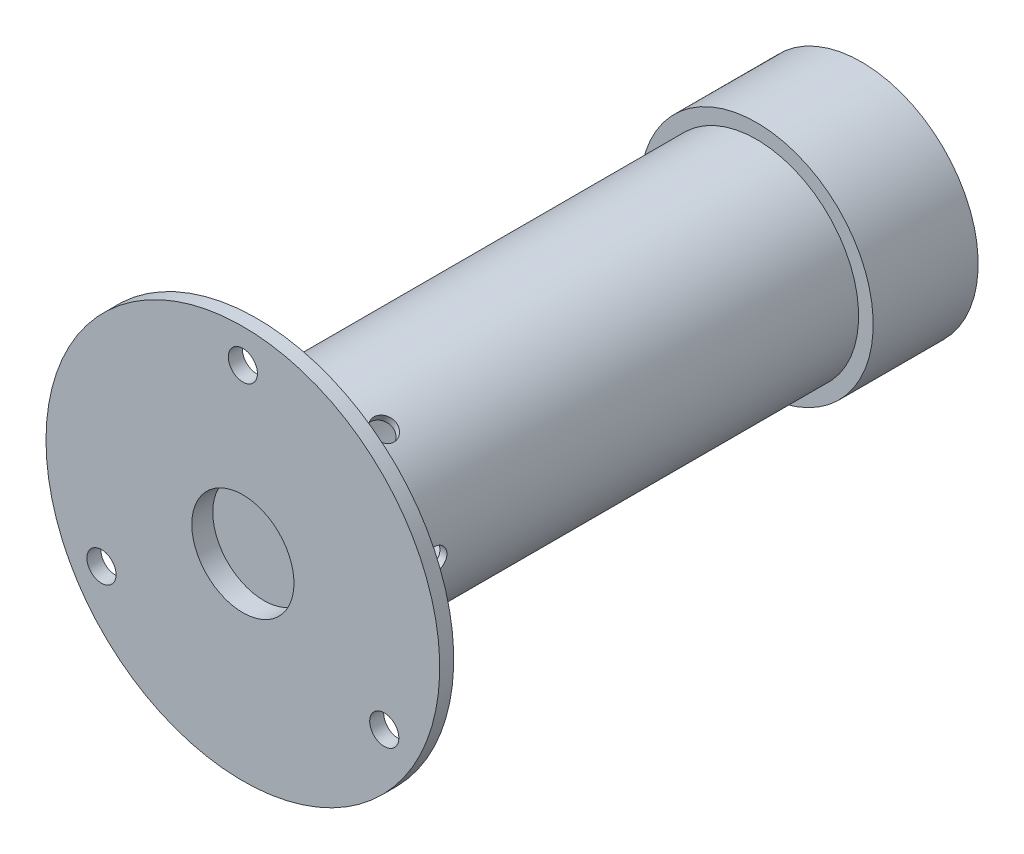
from build123d import *

# Parameters (mm, degrees)
SKETCH1_R           = 21.4376
SKETCH1_R_2         = 5.5626
BOSS_EXTRUDE1_DEPTH = 1.524
SKETCH3_R           = 1.5875
CUT_EXTRUDE1_DEPTH  = 1.524
BOSS_EXTRUDE2_START = 0.762
SKETCH4_R           = 7.62
SKETCH4_R_2         = 5.5626
BOSS_EXTRUDE2_DEPTH = 0.762
SKETCH8_R           = 6.35
CUT_EXTRUDE2_DEPTH  = 2.54
SKETCH10_R          = 1.27
CUT_EXTRUDE8_DEPTH  = 2.54
CIRPATTERN1_COUNT   = 6


# Read off the part's stored shape, not the designer's step: Shell2
with BuildPart() as part:
    # Sketch1 → Boss-Extrude1 (new body)
    with BuildSketch(Plane.XY):
        with Locations(Location((0, 0, 0), (0, 0, 180))):
            Circle(SKETCH1_R)
        with Locations(Location((0, 0, 0), (0, 0, 180))):
            Circle(SKETCH1_R_2, mode=Mode.SUBTRACT)
    extrude(amount=BOSS_EXTRUDE1_DEPTH)

    # Sketch3 → Cut-Extrude1 (cut)
    with BuildSketch(Plane.XY.offset(1.524)):
        with Locations((0, 17.78)):
            Circle(SKETCH3_R)
        with Locations((15.397931679, -8.89)):
            Circle(SKETCH3_R)
        with Locations((-15.397931679, -8.89)):
            Circle(SKETCH3_R)
    extrude(amount=-CUT_EXTRUDE1_DEPTH, mode=Mode.SUBTRACT)

    # Sketch4 → Boss-Extrude2 (add)
    with BuildSketch(Plane(origin=(0, 0, 0), x_dir=(-1, 0, 0), z_dir=(0, 0, -1)).offset(BOSS_EXTRUDE2_START)):
        with Locations(Location((0, 0, 0), (0, 0, 180))):
            Circle(SKETCH4_R)
        Circle(SKETCH4_R_2, mode=Mode.SUBTRACT)
    extrude(amount=-BOSS_EXTRUDE2_DEPTH)

    # Sketch6 → Revolve1 (revolve)
    with BuildSketch(Plane(origin=(0, 0, 0), x_dir=(1, 0, 0), z_dir=(0, 1, 0))):
        Polygon((-12.7, 65.8495), (0, 65.8495), (0, 0.762), (-8.793481231, 0.762), (-11.1125, 4.040809253), (-11.1125, 54.4195), (-12.7, 54.4195), align=None)
    revolve(axis=Axis((0, 0, -48.183080776), (0, 0, 1)))

    # Shell2 outline → Shell2 (revolve, cut)
    with BuildSketch(Plane.XZ):
        Polygon((6.858, 0.762), (6.3246, 0.762), (6.3246, -1.524), (0, -1.524), (0, -65.0875), (11.938, -65.0875), (11.938, -55.1815), (10.3505, -55.1815), (10.3505, -4.283048186), (8.399095074, -1.524), (6.858, -1.524), align=None)
    revolve(axis=Axis((0, 0, 0), (0, 0, 1)), mode=Mode.SUBTRACT)

    # Sketch8 → Cut-Extrude2 (cut)
    with BuildSketch(Plane(origin=(0, 0, -65.8495), x_dir=(-1, 0, 0), z_dir=(0, 0, -1))):
        Circle(SKETCH8_R)
    extrude(amount=-CUT_EXTRUDE2_DEPTH, mode=Mode.SUBTRACT)

    # Sketch10 → Cut-Extrude8 (cut)
    with BuildSketch(Plane(origin=(11.1125, 0, 0), x_dir=(0, 0, -1), z_dir=(1, 0, 0))):
        with Locations((8.318336957, 0)):
            Circle(SKETCH10_R)
    cut_extrude8 = extrude(amount=-CUT_EXTRUDE8_DEPTH, mode=Mode.SUBTRACT)

    # CirPattern1: Cut-Extrude8 ×6 about axis
    cirpattern1_axis = Axis((0, 0, -4.040809253), (0, 0, -1))
    for i in range(1, CIRPATTERN1_COUNT):
        add(cut_extrude8.rotate(cirpattern1_axis, i * 360 / CIRPATTERN1_COUNT), mode=Mode.SUBTRACT)


solid = part.part
